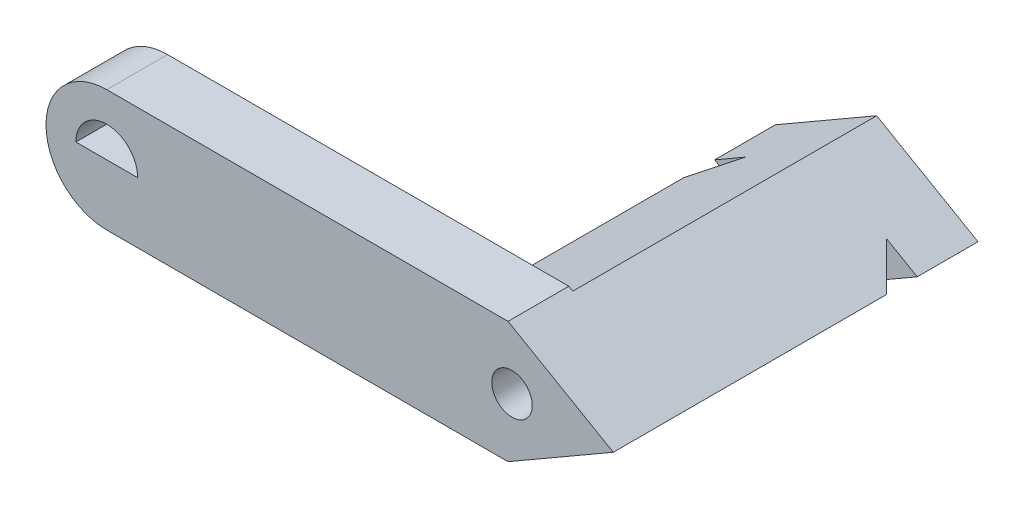
from build123d import *

# Parameters (mm, degrees)
BOSS_EXTRUDE1_DEPTH = 6
CUT_EXTRUDE1_REACH  = 35.779
BOSS_EXTRUDE2_DEPTH = 30
CUT_EXTRUDE2_REACH  = 50.374
SKETCH5_R           = 2
CUT_EXTRUDE3_DEPTH  = 50
CHAMFER1_SIZE       = 10.392304845
CHAMFER1_SIZE_2     = 6
CHAMFER2_SIZE       = 10.392304845
CHAMFER2_SIZE_2     = 6
CUT_EXTRUDE4_DEPTH  = 4


with BuildPart() as part:
    # Sketch1 → Boss-Extrude1 (new body)
    with BuildSketch(Plane.XY):
        with BuildLine():
            Line((-25, 0), (0, 0))
            Line((0, 0), (25, 0))
            Line((25, 0), (25, -12))
            Line((25, -12), (-25, -12))
            ThreePointArc((-25, -12), (-31, -6), (-25, 0))
        make_face()
    extrude(amount=BOSS_EXTRUDE1_DEPTH)

    # Sketch2 → Cut-Extrude1 (cut, up to next)
    with BuildSketch(Plane.XY.offset(6), mode=Mode.PRIVATE) as cut_extrude1_sk1:
        with BuildLine():
            Line((-28.05, -6), (-21.95, -6))
            ThreePointArc((-21.95, -6), (-25, -2.95), (-28.05, -6))
        make_face()
    cut_extrude1_tool1 = extrude(cut_extrude1_sk1.sketch, amount=-CUT_EXTRUDE1_REACH, mode=Mode.PRIVATE) & part.part
    add(cut_extrude1_tool1.solids().sort_by_distance((-25, -4.70554, 6))[0], mode=Mode.SUBTRACT)

    # Sketch3 → Boss-Extrude2 (add)
    with BuildSketch(Plane(origin=(0, 0, 0), x_dir=(-1, 0, 0), z_dir=(0, 0, -1))):
        Polygon((-25, 0), (-5, 0), (-5, -6), (-5, -12), (-25, -12), align=None)
    extrude(amount=BOSS_EXTRUDE2_DEPTH)

    # Sketch4 → Cut-Extrude2 (cut, up to next)
    with BuildSketch(Plane.ZY.offset(-5), mode=Mode.PRIVATE) as cut_extrude2_sk1:
        Polygon((-20.968911087, -6), (-24, -4.25), (-24, -7.75), align=None)
    cut_extrude2_tool1 = extrude(cut_extrude2_sk1.sketch, amount=-CUT_EXTRUDE2_REACH, mode=Mode.PRIVATE) & part.part
    add(cut_extrude2_tool1.solids().sort_by_distance((5, -6, -22.989637))[0], mode=Mode.SUBTRACT)

    # Sketch5 → Cut-Extrude3 (cut, through all)
    with BuildSketch(Plane.XY.offset(6)):
        with Locations((15, -6)):
            Circle(SKETCH5_R)
    extrude(amount=-CUT_EXTRUDE3_DEPTH, mode=Mode.SUBTRACT)

    # Chamfer1
    # the kernel refuses this chamfer: 10.392304845, 6 mm, written as the material it takes off along each edge
    with BuildSketch(Plane(origin=(5, 0, 0), x_dir=(0.9998132206222079, 0.019326765612700622, 0), z_dir=(0, 0, -1))) as chamfer1_piece_1:
        Polygon((CHAMFER1_SIZE * 0.999813220662, CHAMFER1_SIZE * 0.0193267656135), (-CHAMFER1_SIZE_2 * 0.0193267656127, CHAMFER1_SIZE_2 * 0.999813220622), (0, 0), align=None)
    extrude(amount=56.885783824, mode=Mode.SUBTRACT)
    with BuildSketch(Plane(origin=(5, -12, 0), x_dir=(-0.057893862402671484, 0.9983227437537926, 0), z_dir=(0, 0, -1))) as chamfer1_piece_2:
        Polygon((CHAMFER1_SIZE_2 * 0.998322743754, CHAMFER1_SIZE_2 * 0.0578938624027), (-CHAMFER1_SIZE * 0.057893862405, CHAMFER1_SIZE * 0.998322743793), (0, 0), align=None)
    extrude(amount=56.885783824, mode=Mode.SUBTRACT)

    # Chamfer2
    # the kernel refuses this chamfer: 10.392304845, 6 mm, written as the material it takes off along each edge
    with BuildSketch(Plane(origin=(25, -12, 32.885783824), x_dir=(-0.9998132206222079, -0.01932676561270069, 0), z_dir=(0, 0, -1))) as chamfer2_piece_1:
        Polygon((CHAMFER2_SIZE * 0.999813220662, CHAMFER2_SIZE * 0.0193267656135), (-CHAMFER2_SIZE_2 * 0.0193267656127, CHAMFER2_SIZE_2 * 0.999813220622), (0, 0), align=None)
    extrude(amount=89.771567647, mode=Mode.SUBTRACT)
    with BuildSketch(Plane(origin=(25, 0, 32.885783824), x_dir=(-0.9998132206222079, 0.019326765612700622, 0), z_dir=(0, 0, -1))) as chamfer2_piece_2:
        Polygon((CHAMFER2_SIZE * 0.999813220662, -CHAMFER2_SIZE * 0.0193267656135), (-CHAMFER2_SIZE_2 * 0.0193267656127, -CHAMFER2_SIZE_2 * 0.999813220622), (0, 0), align=None)
    extrude(amount=89.771567647, mode=Mode.SUBTRACT)

    # Sketch6 → Cut-Extrude4 (cut)
    with BuildSketch(Plane.XY.offset(-30)):
        Polygon((11.4, -3.921539031), (11.4, -8.078460969), (15, -10.156921938), (18.6, -8.078460969), (18.6, -3.921539031), (15, -1.843078062), align=None)
    extrude(amount=CUT_EXTRUDE4_DEPTH, mode=Mode.SUBTRACT)


solid = part.part
